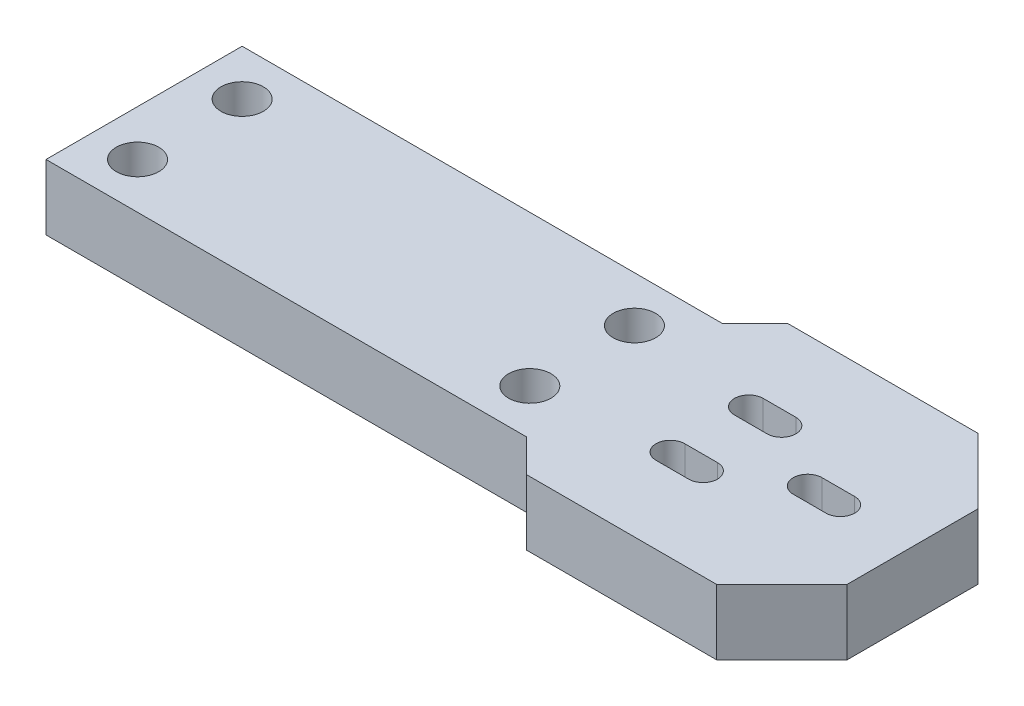
from build123d import *

# Parameters (mm, degrees)
SKETCH1_R           = 3.25
BOSS_EXTRUDE1_DEPTH = 10
CHAMFER1_SIZE       = 10
CHAMFER2_SIZE       = 5


with BuildPart() as part:
    # Sketch1 → Boss-Extrude1 (new body)
    with BuildSketch(Plane(origin=(0, 0, 0), x_dir=(1, 0, 0), z_dir=(0, 1, 0))):
        Polygon((-7, 23), (-7, -7), (66.5, -7), (66.5, -12), (110.55184454, -12), (110.55184454, 28), (66.5, 28), (66.5, 23), align=None)
        with Locations(Location((0, 0, 0), (0, 0, 270))):
            Circle(SKETCH1_R, mode=Mode.SUBTRACT)
        with Locations(Location((0, 16, 0), (0, 0, 270))):
            Circle(SKETCH1_R, mode=Mode.SUBTRACT)
        with Locations(Location((60, 0, 0), (0, 0, 270))):
            Circle(SKETCH1_R, mode=Mode.SUBTRACT)
        with Locations(Location((60, 16, 0), (0, 0, 270))):
            Circle(SKETCH1_R, mode=Mode.SUBTRACT)
        with BuildLine():
            Line((99.5, 5.8), (94.5, 5.8))
            ThreePointArc((94.5, 5.8), (92.3, 8), (94.5, 10.2))
            Line((94.5, 10.2), (99.5, 10.2))
            ThreePointArc((99.5, 10.2), (101.7, 8), (99.5, 5.8))
        make_face(mode=Mode.SUBTRACT)
        with BuildLine():
            Line((84.5, 11.8), (79.5, 11.8))
            ThreePointArc((79.5, 11.8), (77.3, 14), (79.5, 16.2))
            Line((79.5, 16.2), (84.5, 16.2))
            ThreePointArc((84.5, 16.2), (86.7, 14), (84.5, 11.8))
        make_face(mode=Mode.SUBTRACT)
        with BuildLine():
            Line((84.5, -0.2), (79.5, -0.2))
            ThreePointArc((79.5, -0.2), (77.3, 2), (79.5, 4.2))
            Line((79.5, 4.2), (84.5, 4.2))
            ThreePointArc((84.5, 4.2), (86.7, 2), (84.5, -0.2))
        make_face(mode=Mode.SUBTRACT)
    extrude(amount=BOSS_EXTRUDE1_DEPTH)

    # Chamfer1
    chamfer1_edges = [part.edges().sort_by_distance(p)[0] for p in [
        (110.55184454, 5, -28),
        (110.55184454, 5, 12),
    ]]
    chamfer(chamfer1_edges, length=CHAMFER1_SIZE)

    # Chamfer2
    chamfer2_edges = [part.edges().sort_by_distance(p)[0] for p in [
        (66.5, 5, 12),
        (66.5, 5, -28),
    ]]
    chamfer(chamfer2_edges, length=CHAMFER2_SIZE - 0.0001)  # a hair under: the kernel refuses the full size


solid = part.part
